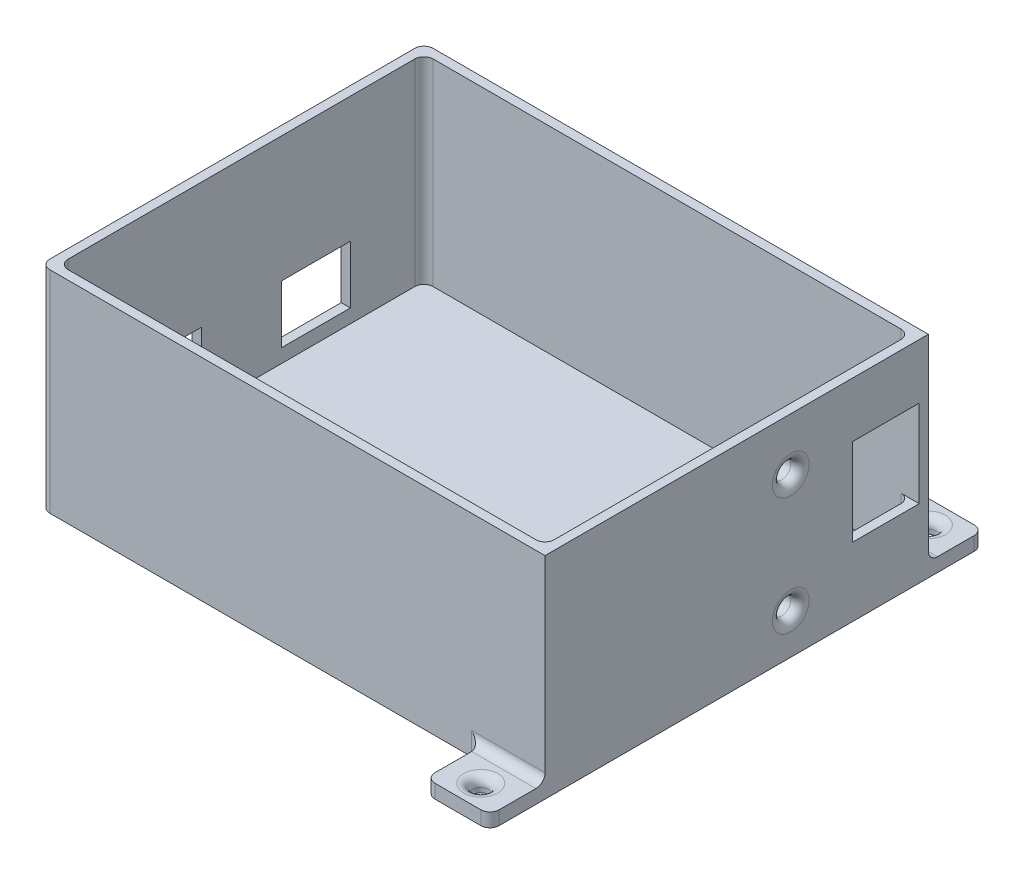
from build123d import *

# Parameters (mm, degrees)
BOSS_EXTRUDE1_DEPTH = 46
BOSS_EXTRUDE2_DEPTH = 3
BOSS_EXTRUDE3_DEPTH = 3
FILLET1_R           = 2
FILLET2_R           = 2
CUT_EXTRUDE5_REACH  = 154.825
SKETCH3_R           = 1.7
FILLET3_R           = 2
CUT_EXTRUDE6_DEPTH  = 43
SKETCH5_W           = 4.6
SKETCH5_H           = 19.4
BOSS_EXTRUDE4_DEPTH = 46
SKETCH6_W           = 4.6
SKETCH6_H           = 19.4
CUT_EXTRUDE8_DEPTH  = 5
SKETCH7_W           = 1.6
SKETCH7_H           = 12.2
CUT_EXTRUDE10_DEPTH = 38
CHAMFER1_SIZE       = 5
SKETCH8_R           = 2
CUT_EXTRUDE11_DEPTH = 34.5
FILLET4_R           = 2
SKETCH12_W          = 15
SKETCH12_H          = 12.6
SKETCH12_W_2        = 10.5
CUT_EXTRUDE13_DEPTH = 34.5
SKETCH14_W          = 14.5
SKETCH14_H          = 19
CUT_EXTRUDE14_DEPTH = 10


with BuildPart() as part:
    # Sketch2 → Boss-Extrude1 (new body)
    with BuildSketch(Plane(origin=(0, 0, 0), x_dir=(1, 0, 0), z_dir=(0, 1, 0))):
        with BuildLine():
            ThreePointArc((-110, 81.6), (-109.414213562, 83.014213562), (-108, 83.6))
            Line((-108, 83.6), (-16, 83.6))
            Line((-16, 83.6), (0, 83.6))
            Line((0, 83.6), (0, 0))
            Line((0, 0), (-16, 0))
            Line((-16, 0), (-108, 0))
            ThreePointArc((-108, 0), (-109.414213562, 0.585786438), (-110, 2))
            Line((-110, 2), (-110, 81.6))
        make_face()
    extrude(amount=BOSS_EXTRUDE1_DEPTH)

    # Sketch2<7> → Boss-Extrude2 (add)
    with BuildSketch(Plane(origin=(0, 0, 0), x_dir=(1, 0, 0), z_dir=(0, 1, 0))):
        with BuildLine():
            ThreePointArc((-16, 83.6), (-14.585786438, 84.185786438), (-14, 85.6))
            Line((-14, 85.6), (-14, 93.6))
            ThreePointArc((-14, 93.6), (-13.414213562, 95.014213562), (-12, 95.6))
            Line((-12, 95.6), (-2, 95.6))
            ThreePointArc((-2, 95.6), (-0.585786438, 95.014213562), (0, 93.6))
            Line((0, 93.6), (0, 83.6))
            Line((0, 83.6), (-16, 83.6))
        make_face()
    extrude(amount=BOSS_EXTRUDE2_DEPTH)

    # Sketch2<8> → Boss-Extrude3 (add)
    with BuildSketch(Plane(origin=(0, 0, 0), x_dir=(1, 0, 0), z_dir=(0, 1, 0))):
        with BuildLine():
            ThreePointArc((0, -10), (-0.585786438, -11.414213562), (-2, -12))
            Line((-2, -12), (-12, -12))
            ThreePointArc((-12, -12), (-13.414213562, -11.414213562), (-14, -10))
            Line((-14, -10), (-14, -2))
            ThreePointArc((-14, -2), (-14.585786438, -0.585786438), (-16, 0))
            Line((-16, 0), (0, 0))
            Line((0, 0), (0, -10))
        make_face()
    extrude(amount=BOSS_EXTRUDE3_DEPTH)

    # Fillet1
    fillet1_edges = [part.edges().sort_by_distance(p)[0] for p in [
        (-8, 3, -83.6),
    ]]
    fillet(fillet1_edges, radius=FILLET1_R)

    # Fillet2
    fillet2_edges = [part.edges().sort_by_distance(p)[0] for p in [
        (-8, 3, 0),
    ]]
    fillet(fillet2_edges, radius=FILLET2_R)

    # Sketch3 → Cut-Extrude5 (cut, up to next)
    with BuildSketch(Plane(origin=(0, 0, 0), x_dir=(1, 0, 0), z_dir=(0, 1, 0)), mode=Mode.PRIVATE) as cut_extrude5_sk1:
        with Locations(Location((-7, -7, 0), (0, 0, 270))):
            Circle(SKETCH3_R)
    cut_extrude5_tool1 = extrude(cut_extrude5_sk1.sketch, amount=CUT_EXTRUDE5_REACH, mode=Mode.PRIVATE) & part.part
    # Sketch3 → Cut-Extrude5 (cut, up to next)
    with BuildSketch(Plane(origin=(0, 0, 0), x_dir=(1, 0, 0), z_dir=(0, 1, 0)), mode=Mode.PRIVATE) as cut_extrude5_sk2:
        with Locations(Location((-7, 90.6, 0), (0, 0, 270))):
            Circle(SKETCH3_R)
    cut_extrude5_tool2 = extrude(cut_extrude5_sk2.sketch, amount=CUT_EXTRUDE5_REACH, mode=Mode.PRIVATE) & part.part
    add(cut_extrude5_tool1.solids().sort_by_distance((-7, 0, 7))[0], mode=Mode.SUBTRACT)
    add(cut_extrude5_tool2.solids().sort_by_distance((-7, 0, -90.6))[0], mode=Mode.SUBTRACT)

    # Fillet3
    fillet3_edges = [part.edges().sort_by_distance(p)[0] for p in [
        (-7, 3, -92.3),
        (-7, 3, 5.3),
    ]]
    fillet(fillet3_edges, radius=FILLET3_R)

    # Sketch4 → Cut-Extrude6 (cut)
    with BuildSketch(Plane(origin=(0, 46, 0), x_dir=(1, 0, 0), z_dir=(0, 1, 0))):
        with BuildLine():
            Line((-106, 81.6), (-4, 81.6))
            ThreePointArc((-4, 81.6), (-2.585786438, 81.014213562), (-2, 79.6))
            Line((-2, 79.6), (-2, 4))
            ThreePointArc((-2, 4), (-2.585786438, 2.585786438), (-4, 2))
            Line((-4, 2), (-106, 2))
            ThreePointArc((-106, 2), (-107.414213562, 2.585786438), (-108, 4))
            Line((-108, 4), (-108, 79.6))
            ThreePointArc((-108, 79.6), (-107.414213562, 81.014213562), (-106, 81.6))
        make_face()
    extrude(amount=-CUT_EXTRUDE6_DEPTH, mode=Mode.SUBTRACT)

    # Sketch5 → Boss-Extrude4 (add)
    with BuildSketch(Plane(origin=(0, 0, 0), x_dir=(1, 0, 0), z_dir=(0, 1, 0))):
        with Locations((-4.3, 53.3)):
            Rectangle(SKETCH5_W, SKETCH5_H)
    extrude(amount=BOSS_EXTRUDE4_DEPTH)

    # Sketch6 → Cut-Extrude8 (cut)
    with BuildSketch(Plane(origin=(0, 46, 0), x_dir=(1, 0, 0), z_dir=(0, 1, 0))):
        with Locations((-4.3, 53.3)):
            Rectangle(SKETCH6_W, SKETCH6_H)
    extrude(amount=-CUT_EXTRUDE8_DEPTH, mode=Mode.SUBTRACT)

    # Sketch7 → Cut-Extrude10 (cut)
    with BuildSketch(Plane(origin=(0, 41, 0), x_dir=(1, 0, 0), z_dir=(0, 1, 0))):
        with Locations((-5.8, 53.3)):
            Rectangle(SKETCH7_W, SKETCH7_H)
    extrude(amount=-CUT_EXTRUDE10_DEPTH, mode=Mode.SUBTRACT)

    # Chamfer1
    # the kernel refuses this chamfer: 5 mm, written as the material it takes off along each edge
    with BuildSketch(Plane(origin=(-6.6, 41, -46.54158506), x_dir=(0.9996219169112968, 0.027495876610586317, 0), z_dir=(0, 0, -1))) as chamfer1_piece_1_section:
        Polygon((CHAMFER1_SIZE * 0.999621916911, CHAMFER1_SIZE * 0.0274958766106), (-CHAMFER1_SIZE * 0.0274958766106, CHAMFER1_SIZE * 0.999621916911), (0, 0), align=None)
    chamfer1_piece_1 = extrude(amount=29.31682988, mode=Mode.PRIVATE)
    chamfer1_piece_1 = split(chamfer1_piece_1, bisect_by=Plane(origin=(-2, 39.327890325, -61.2), z_dir=(-1, 0, 0)), keep=Keep.TOP, mode=Mode.PRIVATE)
    add(chamfer1_piece_1, mode=Mode.SUBTRACT)
    with BuildSketch(Plane(origin=(-6.6, 41, -30.74158506), x_dir=(0.9996219169112968, 0.027495876610586317, 0), z_dir=(0, 0, -1))) as chamfer1_piece_2_section:
        Polygon((CHAMFER1_SIZE * 0.999621916911, CHAMFER1_SIZE * 0.0274958766106), (-CHAMFER1_SIZE * 0.0274958766106, CHAMFER1_SIZE * 0.999621916911), (0, 0), align=None)
    chamfer1_piece_2 = extrude(amount=29.31682988, mode=Mode.PRIVATE)
    chamfer1_piece_2 = split(chamfer1_piece_2, bisect_by=Plane(origin=(-2, 39.327890325, -45.4), z_dir=(-1, 0, 0)), keep=Keep.TOP, mode=Mode.PRIVATE)
    add(chamfer1_piece_2, mode=Mode.SUBTRACT)

    # Sketch8 → Cut-Extrude11 (cut)
    with BuildSketch(Plane(origin=(0, 0, 0), x_dir=(0, 0, -1), z_dir=(1, 0, 0))):
        with Locations((53.6, 8.8)):
            Circle(SKETCH8_R)
        with Locations((53.6, 34.5)):
            Circle(SKETCH8_R)
    extrude(amount=-CUT_EXTRUDE11_DEPTH, mode=Mode.SUBTRACT)

    # Fillet4
    fillet4_edges = [part.edges().sort_by_distance(p)[0] for p in [
        (0, 8.8, -51.6),
        (0, 34.5, -51.6),
    ]]
    fillet(fillet4_edges, radius=FILLET4_R)

    # Sketch12 → Cut-Extrude13 (cut)
    with BuildSketch(Plane.ZY.offset(110)):
        with Locations((-58.05, 12.3)):
            Rectangle(SKETCH12_W, SKETCH12_H)
        with Locations((-27.8, 12.3)):
            Rectangle(SKETCH12_W_2, SKETCH12_H)
    extrude(amount=-CUT_EXTRUDE13_DEPTH, mode=Mode.SUBTRACT)

    # Sketch14 → Cut-Extrude14 (cut)
    with BuildSketch(Plane(origin=(0, 0, 0), x_dir=(0, 0, -1), z_dir=(1, 0, 0))):
        with Locations((74.35, 24.5)):
            Rectangle(SKETCH14_W, SKETCH14_H)
    extrude(amount=-CUT_EXTRUDE14_DEPTH, mode=Mode.SUBTRACT)


solid = part.part
